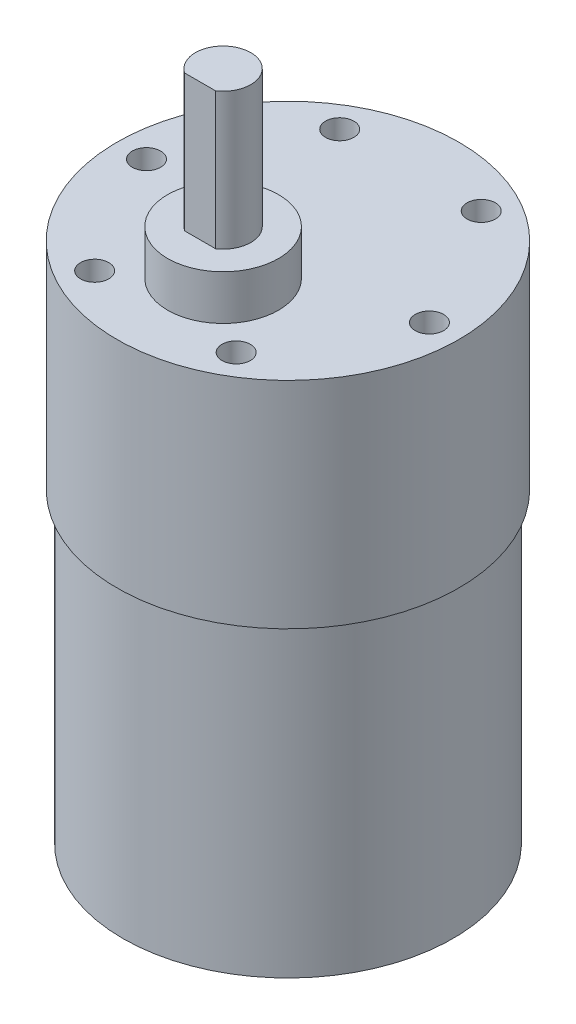
from build123d import *

# Parameters (mm, degrees)
SKETCH1_R           = 17.78
BOSS_EXTRUDE1_DEPTH = 33.02
SKETCH2_R           = 18.415
BOSS_EXTRUDE2_DEPTH = 23.1775
SKETCH3_R           = 1.524
CUT_EXTRUDE1_DEPTH  = 12.7
SKETCH4_R           = 5.969
BOSS_EXTRUDE3_DEPTH = 4.826
BOSS_EXTRUDE4_DEPTH = 14.732


with BuildPart() as part:
    # Sketch1 → Boss-Extrude1 (new body)
    with BuildSketch(Plane(origin=(0, 0, 0), x_dir=(1, 0, 0), z_dir=(0, 1, 0))):
        Circle(SKETCH1_R)
    extrude(amount=BOSS_EXTRUDE1_DEPTH)

    # Sketch2 → Boss-Extrude2 (add)
    with BuildSketch(Plane(origin=(0, 33.02, 0), x_dir=(1, 0, 0), z_dir=(0, 1, 0))):
        Circle(SKETCH2_R)
    extrude(amount=BOSS_EXTRUDE2_DEPTH)

    # Sketch3 → Cut-Extrude1 (cut)
    with BuildSketch(Plane(origin=(0, 56.1975, 0), x_dir=(1, 0, 0), z_dir=(0, 1, 0))):
        with Locations((15.24, 0)):
            Circle(SKETCH3_R)
        with Locations((7.62, -13.198227154)):
            Circle(SKETCH3_R)
        with Locations((-7.62, -13.198227154)):
            Circle(SKETCH3_R)
        with Locations((-15.24, 0)):
            Circle(SKETCH3_R)
        with Locations((-7.62, 13.198227154)):
            Circle(SKETCH3_R)
        with Locations((7.62, 13.198227154)):
            Circle(SKETCH3_R)
    extrude(amount=-CUT_EXTRUDE1_DEPTH, mode=Mode.SUBTRACT)

    # Sketch4 → Boss-Extrude3 (add)
    with BuildSketch(Plane(origin=(0, 56.1975, 0), x_dir=(1, 0, 0), z_dir=(0, 1, 0))):
        with Locations((0, -6.985)):
            Circle(SKETCH4_R)
    extrude(amount=BOSS_EXTRUDE3_DEPTH)

    # Sketch5 → Boss-Extrude4 (add)
    with BuildSketch(Plane(origin=(0, 61.0235, 0), x_dir=(1, 0, 0), z_dir=(0, 1, 0))):
        with BuildLine():
            Line((-1.665589385, -9.4615), (1.665589385, -9.4615))
            ThreePointArc((1.665589385, -9.4615), (0, -4.0005), (-1.665589385, -9.4615))
        make_face()
    extrude(amount=BOSS_EXTRUDE4_DEPTH)


solid = part.part
